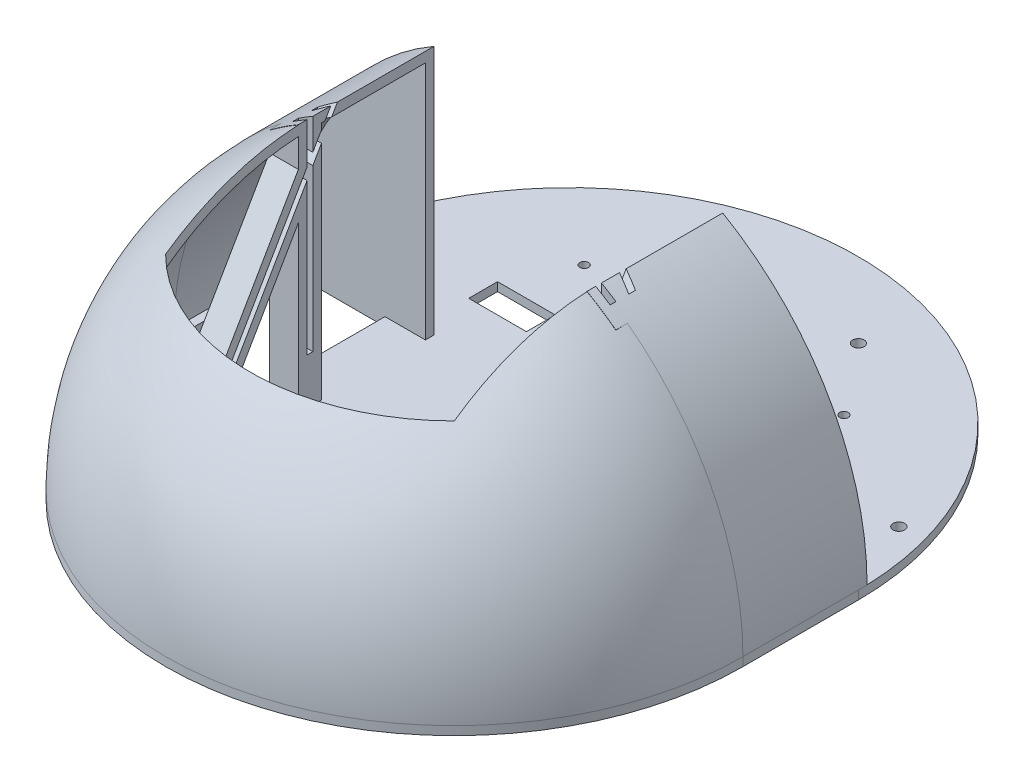
from build123d import *

# Parameters (mm, degrees)
SKETCH_1_R                  = 100
SKETCH_1_W                  = 200
SKETCH_1_H                  = 40
EXTRUDE_532_DEPTH           = 3
SKETCH_3_W                  = 30
SKETCH_3_H                  = 40
SKETCH_3_W_2                = 20
SKETCH_3_H_2                = 10
SKETCH_3_H_3                = 30
CUT_EXTRUDE_1401_DEPTH      = 3
SKETCH_2_R                  = 2
SKETCH_2_R_2                = 1.5
CUT_EXTRUDE_2575_DEPTH      = 173.072659072
REVOLVE_3198_ANGLE          = 90
EXTRUDE_3399_DEPTH          = 40
SKETCH_8_W                  = 10
SKETCH_8_H                  = 8
EXTRUDE_L_DEPTH             = 100
EXTRUDE_L_32_DEPTH          = 10
SKETCH_16_W                 = 2
SKETCH_16_H                 = 84
CUT_EXTRUDE_L_DEPTH         = 5
SKETCH_23_W                 = 200
SKETCH_23_H                 = 3
EXTRUDE_5715_DEPTH          = 100
CUT_EXTRUDE_6135_DEPTH      = 100
CUT_EXTRUDE_6135_DEPTH_BACK = 100
CUT_EXTRUDE_7004_DEPTH      = 100


with BuildPart() as part:
    # 草图1 → Extrude 532 (new body)
    with BuildSketch(Plane(origin=(0, 0, 0), x_dir=(1, 0, 0), z_dir=(0, 1, 0))):
        Circle(SKETCH_1_R)
        with Locations((0, 40)):
            Circle(SKETCH_1_R)
        with Locations((0, 20)):
            Rectangle(SKETCH_1_W, SKETCH_1_H)
    extrude(amount=EXTRUDE_532_DEPTH)

    # 草图3 → Cut-Extrude 1401 (cut)
    with BuildSketch(Plane(origin=(0, 3, 0), x_dir=(1, 0, 0), z_dir=(0, 1, 0))):
        with Locations((-79, 20)):
            Rectangle(SKETCH_3_W, SKETCH_3_H)
        with Locations((79, 20)):
            Rectangle(SKETCH_3_W, SKETCH_3_H)
        with Locations((45, 65)):
            Rectangle(SKETCH_3_W_2, SKETCH_3_H_2)
        with Locations((0, -52)):
            Rectangle(SKETCH_3_W_2, SKETCH_3_H_3)
        with Locations((-45, 65)):
            Rectangle(SKETCH_3_W_2, SKETCH_3_H_2)
    extrude(amount=-CUT_EXTRUDE_1401_DEPTH, mode=Mode.SUBTRACT)

    # 草图2 → Cut-Extrude 2575 (cut, through all)
    with BuildSketch(Plane(origin=(0, 3, 0), x_dir=(1, 0, 0), z_dir=(0, 1, 0))):
        with Locations((-45, -22)):
            Circle(SKETCH_2_R)
        with Locations((-40, -82)):
            Circle(SKETCH_2_R)
        with Locations((-88, 66)):
            Circle(SKETCH_2_R)
        with Locations((-26, 66)):
            Circle(SKETCH_2_R)
        with Locations((-26, 114)):
            Circle(SKETCH_2_R)
        with Locations((40, -82)):
            Circle(SKETCH_2_R)
        with Locations((45, -22)):
            Circle(SKETCH_2_R)
        with Locations((26, 114)):
            Circle(SKETCH_2_R)
        with Locations((26, 66)):
            Circle(SKETCH_2_R)
        with Locations((88, 66)):
            Circle(SKETCH_2_R)
        with Locations((-45, 90)):
            Circle(SKETCH_2_R_2)
        with Locations((45, 90)):
            Circle(SKETCH_2_R_2)
    extrude(amount=-CUT_EXTRUDE_2575_DEPTH, mode=Mode.SUBTRACT)

    # 草图18 → Revolve 3198 (revolve)
    with BuildSketch(Plane(origin=(0, 3, 0), x_dir=(1, 0, 0), z_dir=(0, 1, 0))):
        with BuildLine():
            Line((-97, 0), (-100, 0))
            ThreePointArc((-100, 0), (0, -100), (100, 0))
            Line((100, 0), (97, 0))
            ThreePointArc((97, 0), (0, -97), (-97, 0))
        make_face()
    revolve(axis=Axis((-100, 3, 0), (-1, 0, 0)), revolution_arc=REVOLVE_3198_ANGLE)

    # 草图19 → Extrude 3399 (add)
    with BuildSketch(Plane(origin=(0, 0, 0), x_dir=(-1, 0, 0), z_dir=(0, 0, -1))):
        with BuildLine():
            Line((97, 3), (100, 3))
            ThreePointArc((100, 3), (0, 103), (-100, 3))
            Line((-100, 3), (-97, 3))
            ThreePointArc((-97, 3), (0, 100), (97, 3))
        make_face()
    extrude(amount=EXTRUDE_3399_DEPTH)

    # 草图8 → 安装架-L-树莓派 (add)
    with BuildSketch(Plane(origin=(0, 3, 0), x_dir=(1, 0, 0), z_dir=(0, 1, 0))):
        with Locations((-55, 0)):
            Rectangle(SKETCH_8_W, SKETCH_8_H)
    extrude_l = extrude(amount=EXTRUDE_L_DEPTH)

    # 草图11 → 安装架-L-32 (add)
    with BuildSketch(Plane.ZY.offset(60)):
        Polygon((37, 3), (4, 60.15767665), (3.758069686, 76.576712245), (46.237604307, 3), align=None)
    extrude_l_32 = extrude(amount=-EXTRUDE_L_32_DEPTH)

    # 草图16 → 安装架-L-凹槽 (cut)
    with BuildSketch(Plane(origin=(-50, 0, 0), x_dir=(0, 0, -1), z_dir=(1, 0, 0))):
        Polygon((-32.464101615, 16.856406461), (-34.196152423, 17.856406461), (15.803847577, 104.458946839), (17.535898385, 103.458946839), align=None)
        with Locations((0, 61)):
            Rectangle(SKETCH_16_W, SKETCH_16_H)
    cut_extrude_l = extrude(amount=-CUT_EXTRUDE_L_DEPTH, mode=Mode.SUBTRACT)

    # 安装架-R: 安装架-L-树莓派, 安装架-L-32, 安装架-L-凹槽 across plane
    add(extrude_l.mirror(Plane(origin=(0, 0, 0), x_dir=(0, 0, 1), z_dir=(1, 0, 0))))
    add(extrude_l_32.mirror(Plane(origin=(0, 0, 0), x_dir=(0, 0, 1), z_dir=(1, 0, 0))))
    add(cut_extrude_l.mirror(Plane(origin=(0, 0, 0), x_dir=(0, 0, 1), z_dir=(1, 0, 0))), mode=Mode.SUBTRACT)

    # 草图23 → Extrude 5715 (add)
    with BuildSketch(Plane(origin=(0, 3, 0), x_dir=(1, 0, 0), z_dir=(0, 1, 0))):
        with Locations((0, 41.5)):
            Rectangle(SKETCH_23_W, SKETCH_23_H)
    extrude(amount=EXTRUDE_5715_DEPTH)

    # 草图24 → Cut-Extrude 6135 (cut, two sides: drawn at the far end of the back side and taken through both)
    with BuildSketch(Plane.XY.offset(-40).offset(-CUT_EXTRUDE_6135_DEPTH_BACK)):
        with BuildLine():
            Line((-150, 3), (-100, 3))
            ThreePointArc((-100, 3), (0, 103), (100, 3))
            Line((100, 3), (150, 3))
            ThreePointArc((150, 3), (0, 153), (-150, 3))
        make_face()
    extrude(amount=CUT_EXTRUDE_6135_DEPTH + CUT_EXTRUDE_6135_DEPTH_BACK, mode=Mode.SUBTRACT)

    # 草图21 → Cut-Extrude 7004 (cut)
    with BuildSketch(Plane(origin=(0, 3, 0), x_dir=(1, 0, 0), z_dir=(0, 1, 0))):
        with BuildLine():
            Line((50, -50), (50, 50))
            Line((50, 50), (-50, 50))
            Line((-50, 50), (-50, -50))
            ThreePointArc((-50, -50), (0, -70.710678119), (50, -50))
        make_face()
    extrude(amount=CUT_EXTRUDE_7004_DEPTH, mode=Mode.SUBTRACT)


solid = part.part
